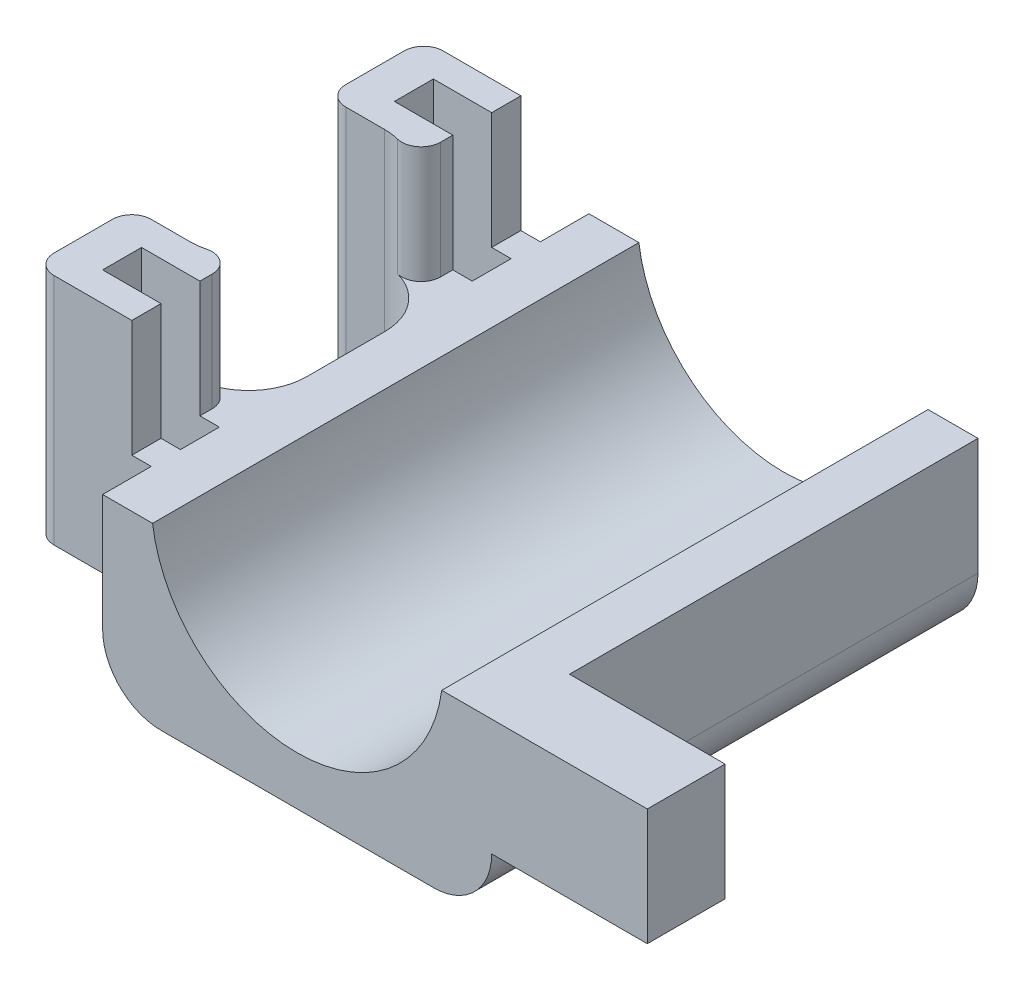
from build123d import *

# Parameters (mm, degrees)
ESBO_O1_W                = 20
ESBO_O1_H                = 25
RESSALTO_EXTRUS_O1_DEPTH = 9
ESBO_O2_R                = 7.5
CORTE_EXTRUS_O1_DEPTH    = 29.390139133
FILETE1_R                = 3
RESSALTO_EXTRUS_O2_DEPTH = 6
RESSALTO_EXTRUS_O3_DEPTH = 6
FILETE3_R                = 1
FILETE5_R                = 3
FILETE6_R                = 1
ESBO_O5_W                = 4
ESBO_O5_H                = 6
RESSALTO_EXTRUS_O4_DEPTH = 8


with BuildPart() as part:
    # Esboço1 → Ressalto-extrusão1 (new body)
    with BuildSketch(Plane(origin=(0, 0, 0), x_dir=(1, 0, 0), z_dir=(0, 1, 0))):
        Rectangle(ESBO_O1_W, ESBO_O1_H)
    extrude(amount=RESSALTO_EXTRUS_O1_DEPTH)

    # Esboço2 → Corte-extrusão1 (cut, through all)
    with BuildSketch(Plane.XY.offset(12.5)):
        with Locations((0, 10)):
            Circle(ESBO_O2_R)
    extrude(amount=-CORTE_EXTRUS_O1_DEPTH, mode=Mode.SUBTRACT)

    # Filete1
    filete1_edges = [part.edges().sort_by_distance(p)[0] for p in [
        (-10, 0, 0),
        (10, 0, 0),
    ]]
    fillet(filete1_edges, radius=FILETE1_R)

    # Esboço3 → Ressalto-extrusão2 (add)
    with BuildSketch(Plane(origin=(0, 9, 0), x_dir=(1, 0, 0), z_dir=(0, 1, 0))):
        Polygon((-16, 10), (-10, 10), (-10, 8.5), (-14, 8.5), (-14, 6.5), (-10, 6.5), (-10, 5), (-16, 5), align=None)
        Polygon((-14, -6.5), (-10, -6.5), (-10, -5), (-16, -5), (-16, -10), (-10, -10), (-10, -8.5), (-14, -8.5), align=None)
    extrude(amount=-RESSALTO_EXTRUS_O2_DEPTH)

    # Esboço4 → Ressalto-extrusão3 (add)
    with BuildSketch(Plane(origin=(0, 9, 0), x_dir=(1, 0, 0), z_dir=(0, 1, 0))):
        Polygon((-16, -10), (-16, -5), (-11, -5), (-11, -6.5), (-14, -6.5), (-14, -8.5), (-11, -8.5), (-11, -10), align=None)
        Polygon((-11, 10), (-16, 10), (-16, 5), (-11, 5), (-11, 6.5), (-14, 6.5), (-14, 8.5), (-11, 8.5), align=None)
    extrude(amount=RESSALTO_EXTRUS_O3_DEPTH)

    # Filete3
    filete3_edges = [part.edges().sort_by_distance(p)[0] for p in [
        (-16, 9, -5),
        (-16, 9, -10),
        (-16, 9, 10),
        (-16, 9, 5),
    ]]
    fillet(filete3_edges, radius=FILETE3_R)

    # Filete5
    # the kernel refuses this fillet: 3 mm, written as the material it adds along each edge
    with BuildSketch(Plane(origin=(-10, 16.5, -5), x_dir=(-1, 0, 0), z_dir=(0, -1, 0))) as filete5_piece_1_section:
        with BuildLine():
            CenterArc((FILETE5_R, -FILETE5_R), FILETE5_R, 90, 90)
            Line((0, -FILETE5_R), (0, 0))
            Line((0, 0), (FILETE5_R, 0))
        make_face()
    filete5_piece_1 = extrude(amount=13.5, mode=Mode.PRIVATE)
    filete5_piece_1 = split(filete5_piece_1, bisect_by=Plane(origin=(-11.589070595, 9, -4.827479681), z_dir=(0, 1, 0)), keep=Keep.TOP, mode=Mode.PRIVATE)
    filete5_piece_1 = split(filete5_piece_1, bisect_by=Plane(origin=(-11, 12, -4.827479681), z_dir=(-1, 0, 0)), keep=Keep.TOP, mode=Mode.PRIVATE)
    filete5_piece_1 = split(filete5_piece_1, bisect_by=Plane(origin=(-11.589070595, 15, -4.827479681), z_dir=(0, -1, 0)), keep=Keep.TOP, mode=Mode.PRIVATE)
    add(filete5_piece_1)
    with BuildSketch(Plane(origin=(-10, 9, -5), x_dir=(-1, 0, 0), z_dir=(0, -1, 0))) as filete5_piece_2_section:
        with BuildLine():
            CenterArc((FILETE5_R, -FILETE5_R), FILETE5_R, 90, 90)
            Line((0, -FILETE5_R), (0, 0))
            Line((0, 0), (FILETE5_R, 0))
        make_face()
    filete5_piece_2 = extrude(amount=6, mode=Mode.PRIVATE)
    filete5_piece_2 = split(filete5_piece_2, bisect_by=Plane(origin=(-11, 6, -4.827479681), z_dir=(-1, 0, 0)), keep=Keep.TOP, mode=Mode.PRIVATE)
    add(filete5_piece_2)
    with BuildSketch(Plane(origin=(-10, 9, -5), x_dir=(-1, 0, 0), z_dir=(0, -1, 0))) as filete5_piece_3_section:
        with BuildLine():
            CenterArc((FILETE5_R, -FILETE5_R), FILETE5_R, 90, 90)
            Line((0, -FILETE5_R), (0, 0))
            Line((0, 0), (FILETE5_R, 0))
        make_face()
    filete5_piece_3 = extrude(amount=6, mode=Mode.PRIVATE)
    filete5_piece_3 = split(filete5_piece_3, bisect_by=Plane(origin=(-11, 6, -4.141402177), z_dir=(1, 0, 0)), keep=Keep.TOP, mode=Mode.PRIVATE)
    add(filete5_piece_3)
    with BuildSketch(Plane(origin=(-10, 16.5, 5), x_dir=(-1, 0, 0), z_dir=(0, -1, 0))) as filete5_piece_4_section:
        with BuildLine():
            CenterArc((FILETE5_R, FILETE5_R), FILETE5_R, 180, 90)
            Line((0, FILETE5_R), (0, 0))
            Line((0, 0), (FILETE5_R, 0))
        make_face()
    filete5_piece_4 = extrude(amount=13.5, mode=Mode.PRIVATE)
    filete5_piece_4 = split(filete5_piece_4, bisect_by=Plane(origin=(-11.589070595, 15, 4.827479681), z_dir=(0, -1, 0)), keep=Keep.TOP, mode=Mode.PRIVATE)
    filete5_piece_4 = split(filete5_piece_4, bisect_by=Plane(origin=(-11.589070595, 9, 4.827479681), z_dir=(0, 1, 0)), keep=Keep.TOP, mode=Mode.PRIVATE)
    filete5_piece_4 = split(filete5_piece_4, bisect_by=Plane(origin=(-11, 12, 4.827479681), z_dir=(-1, 0, 0)), keep=Keep.TOP, mode=Mode.PRIVATE)
    add(filete5_piece_4)
    with BuildSketch(Plane(origin=(-10, 9, 5), x_dir=(-1, 0, 0), z_dir=(0, -1, 0))) as filete5_piece_5_section:
        with BuildLine():
            CenterArc((FILETE5_R, FILETE5_R), FILETE5_R, 180, 90)
            Line((0, FILETE5_R), (0, 0))
            Line((0, 0), (FILETE5_R, 0))
        make_face()
    filete5_piece_5 = extrude(amount=6, mode=Mode.PRIVATE)
    filete5_piece_5 = split(filete5_piece_5, bisect_by=Plane(origin=(-11, 6, 4.827479681), z_dir=(-1, 0, 0)), keep=Keep.TOP, mode=Mode.PRIVATE)
    add(filete5_piece_5)
    with BuildSketch(Plane(origin=(-10, 9, 5), x_dir=(-1, 0, 0), z_dir=(0, -1, 0))) as filete5_piece_6_section:
        with BuildLine():
            CenterArc((FILETE5_R, FILETE5_R), FILETE5_R, 180, 90)
            Line((0, FILETE5_R), (0, 0))
            Line((0, 0), (FILETE5_R, 0))
        make_face()
    filete5_piece_6 = extrude(amount=6, mode=Mode.PRIVATE)
    filete5_piece_6 = split(filete5_piece_6, bisect_by=Plane(origin=(-11, 6, 4.141402177), z_dir=(1, 0, 0)), keep=Keep.TOP, mode=Mode.PRIVATE)
    add(filete5_piece_6)

    # Filete6
    filete6_edges = [part.edges().sort_by_distance(p)[0] for p in [
        (-11, 12, -4.236067977),
        (-11, 12, 4.236067977),
    ]]
    fillet(filete6_edges, radius=FILETE6_R)

    # Esboço5 → Ressalto-extrusão4 (add)
    with BuildSketch(Plane(origin=(10, 0, 0), x_dir=(0, 0, -1), z_dir=(1, 0, 0))):
        with Locations((-10.5, 6)):
            Rectangle(ESBO_O5_W, ESBO_O5_H)
    extrude(amount=RESSALTO_EXTRUS_O4_DEPTH)


solid = part.part
